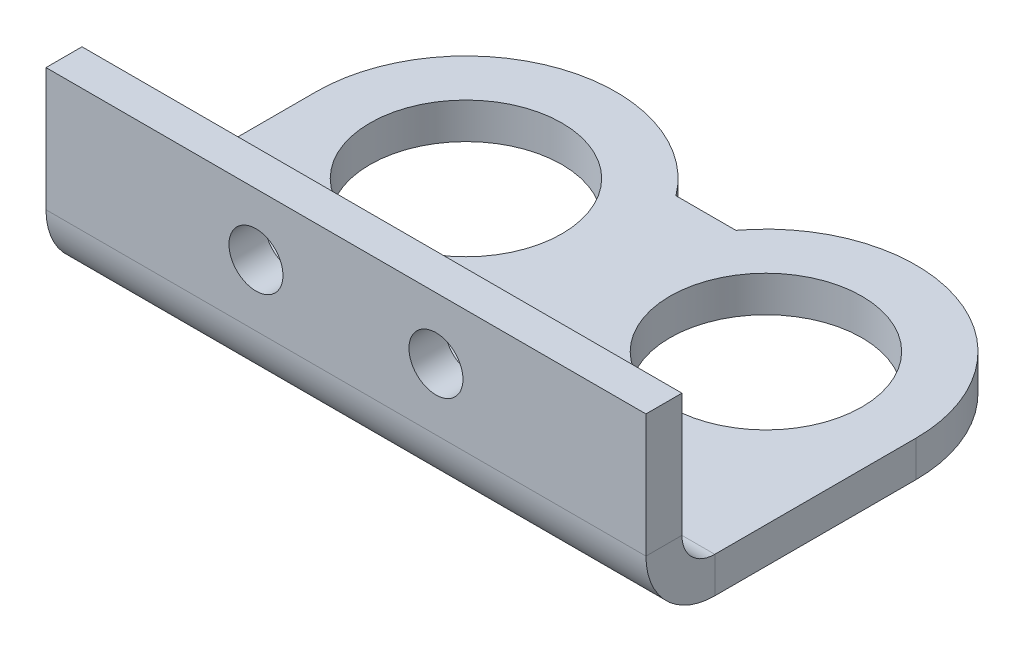
from build123d import *

# Parameters (mm, degrees)
SKETCH_1_R                       = 8
SM_BASE_FLANGE_1_DEPTH           = 3
SM_EDGE_FLANGE_1_STRIP_W         = 17.4732
SM_EDGE_FLANGE_1_STRIP_H         = 3
SM_EDGE_FLANGE_1_STRIP_CUT_DEPTH = 50
SM_EDGE_FLANGE_1_DEPTH           = 50
SKETCH_9_R                       = 2.25
CUT_EXTRUDE_1_DEPTH              = 10


# Sheet-metal steps are written as plain solids
with BuildPart() as part:
    # Sketch 1 → 基体-法兰1 (new body)
    with BuildSketch(Plane(origin=(0, 0, 0), x_dir=(1, 0, 0), z_dir=(0, 1, 0))):
        with BuildLine():
            Line((-25, 22.5), (-25, 0))
            Line((-25, 0), (25, 0))
            Line((25, 0), (25, 22.5))
            ThreePointArc((25, 22.5), (16.452847075, 34.358541226), (2.5, 30))
            Line((2.5, 30), (-2.5, 30))
            ThreePointArc((-2.5, 30), (-16.452847075, 34.358541226), (-25, 22.5))
        make_face()
        with Locations(Location((-12.5, 22.5, 0), (0, 0, 270))):
            Circle(SKETCH_1_R, mode=Mode.SUBTRACT)
        with Locations(Location((12.5, 22.5, 0), (0, 0, 90))):
            Circle(SKETCH_1_R, mode=Mode.SUBTRACT)
    extrude(amount=-SM_BASE_FLANGE_1_DEPTH)

    # 边线-法兰1 strip (across the edge) → 边线-法兰1 strip cut (cut)
    with BuildSketch(Plane(origin=(-25, 0, 0), x_dir=(0, 0, -1), z_dir=(1, 0, 0))):
        with Locations((-3, -1.5)):
            Rectangle(SM_EDGE_FLANGE_1_STRIP_W, SM_EDGE_FLANGE_1_STRIP_H)
    extrude(amount=SM_EDGE_FLANGE_1_STRIP_CUT_DEPTH, mode=Mode.SUBTRACT)

    # 边线-法兰1 section (across the edge) → 边线-法兰1 (add)
    with BuildSketch(Plane(origin=(-25, 0, 0), x_dir=(0, 0, -1), z_dir=(1, 0, 0))):
        with BuildLine():
            Line((0, 2.7366), (0, 13))
            Line((0, 13), (3, 13))
            Line((3, 13), (3, 2.7366))
            ThreePointArc((3, 2.7366), (3.801531583, 0.801531583), (5.7366, 0))
            Line((5.7366, 0), (5.7366, -3))
            ThreePointArc((5.7366, -3), (1.680211239, -1.319788761), (0, 2.7366))
        make_face()
    extrude(amount=SM_EDGE_FLANGE_1_DEPTH)

    # 草图9 → 切除-拉伸1 (cut)
    with BuildSketch(Plane.XY):
        with Locations((7.5, 7.8683)):
            Circle(SKETCH_9_R)
        with Locations(Location((-7.5, 7.8683, 0), (0, 0, 270))):
            Circle(SKETCH_9_R)
    extrude(amount=-CUT_EXTRUDE_1_DEPTH, mode=Mode.SUBTRACT)


solid = part.part
